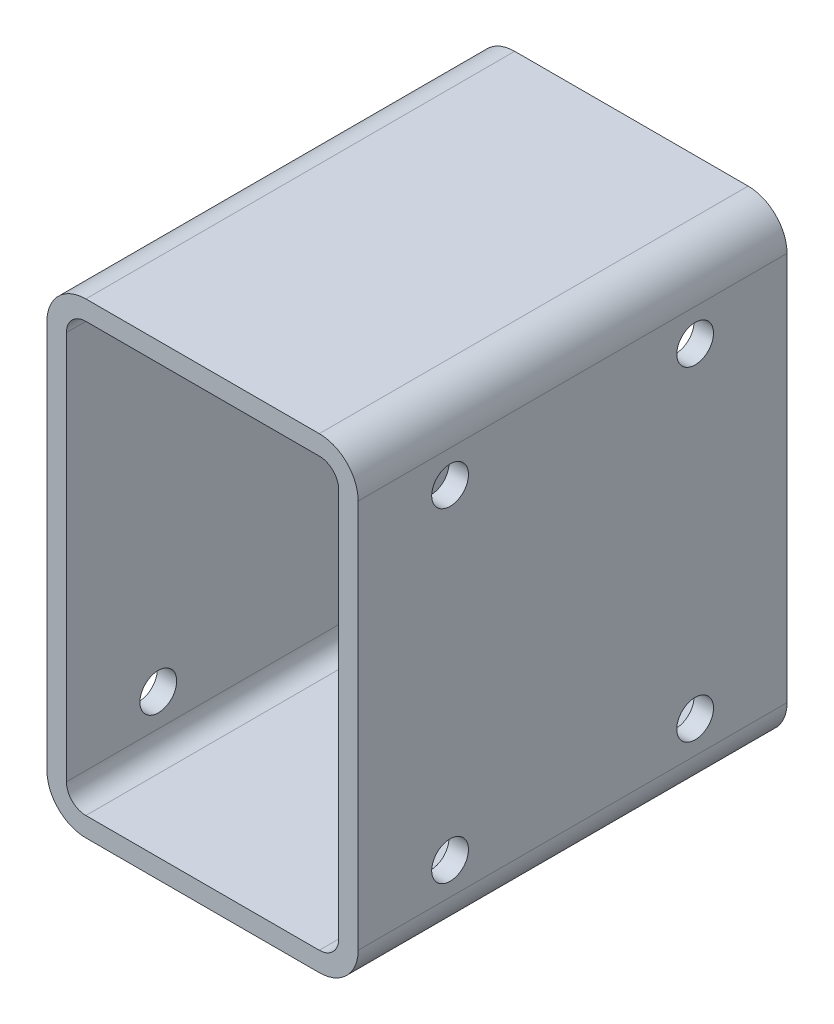
from build123d import *

# Parameters (mm, degrees)
CNC_3X2X0_125_1_DEPTH   = 70
CUT_EXTRUDE1_DEPTH      = 58.634798516
CUT_EXTRUDE1_DEPTH_BACK = 58.634798516
SKETCH2_R               = 3


with BuildPart() as part:
    # Sketch12 → Cnc 3X2X0.125(1) (new body)
    with BuildSketch(Plane.YX.offset(-35)):
        with BuildLine():
            Line((31.75, -25.4), (-31.75, -25.4))
            ThreePointArc((-31.75, -25.4), (-36.240128061, -23.540128061), (-38.1, -19.05))
            Line((-38.1, -19.05), (-38.1, 19.05))
            ThreePointArc((-38.1, 19.05), (-36.240128061, 23.540128061), (-31.75, 25.4))
            Line((-31.75, 25.4), (31.75, 25.4))
            ThreePointArc((31.75, 25.4), (36.240128061, 23.540128061), (38.1, 19.05))
            Line((38.1, 19.05), (38.1, -19.05))
            ThreePointArc((38.1, -19.05), (36.240128061, -23.540128061), (31.75, -25.4))
        make_face()
        with BuildLine():
            Line((31.75, 22.225), (-31.75, 22.225))
            ThreePointArc((-31.75, 22.225), (-33.99506403, 21.29506403), (-34.925, 19.05))
            Line((-34.925, 19.05), (-34.925, -19.05))
            ThreePointArc((-34.925, -19.05), (-33.99506403, -21.29506403), (-31.75, -22.225))
            Line((-31.75, -22.225), (31.75, -22.225))
            ThreePointArc((31.75, -22.225), (33.99506403, -21.29506403), (34.925, -19.05))
            Line((34.925, -19.05), (34.925, 19.05))
            ThreePointArc((34.925, 19.05), (33.99506403, 21.29506403), (31.75, 22.225))
        make_face(mode=Mode.SUBTRACT)
    extrude(amount=CNC_3X2X0_125_1_DEPTH)

    # Sketch2 → Cut-Extrude1 (cut, two sides: drawn at the far end of the back side and taken through both)
    with BuildSketch(Plane(origin=(0, 0, 0), x_dir=(0, 0, -1), z_dir=(1, 0, 0)).offset(-CUT_EXTRUDE1_DEPTH_BACK)):
        with Locations((-20, 26.5)):
            Circle(SKETCH2_R)
        with Locations((20, 26.5)):
            Circle(SKETCH2_R)
        with Locations((20, -26.5)):
            Circle(SKETCH2_R)
        with Locations((-20, -26.5)):
            Circle(SKETCH2_R)
    extrude(amount=CUT_EXTRUDE1_DEPTH + CUT_EXTRUDE1_DEPTH_BACK, mode=Mode.SUBTRACT)


solid = part.part
